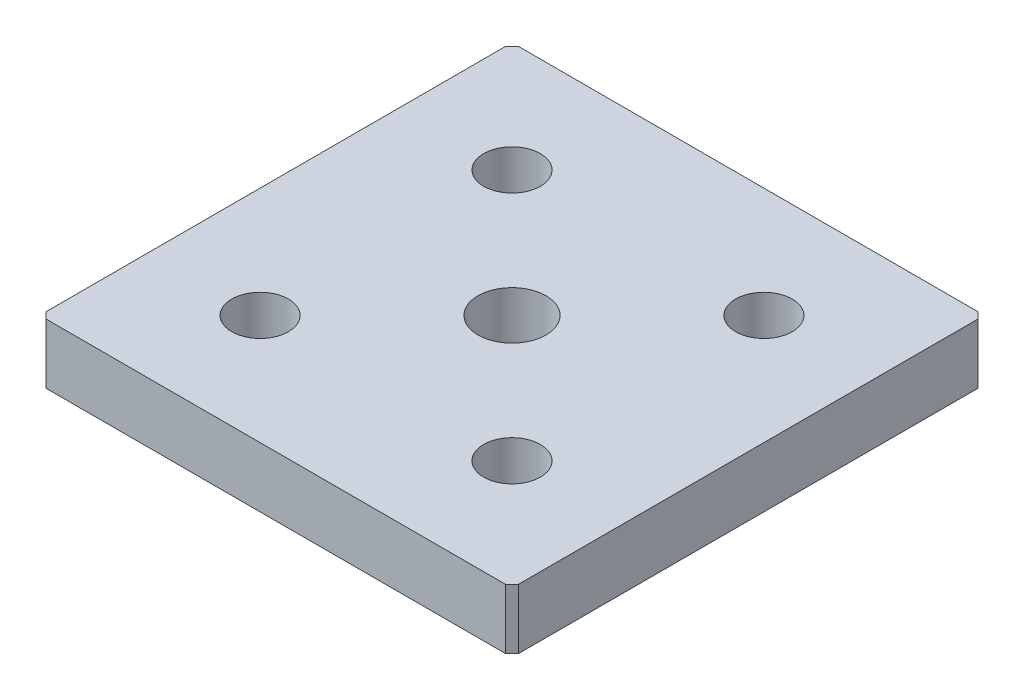
from build123d import *

# Parameters (mm, degrees)
SKETCH1_W               = 75
SKETCH1_H               = 75
BOSS_EXTRUDE1_DEPTH     = 4.7625
M8_CLEARANCE_HOLE1_D    = 9
M12X1_25_TAPPED_HOLE1_D = 10.8
CHAMFER1_SIZE           = 1


with BuildPart() as part:
    # Sketch1 → Boss-Extrude1 (new, symmetric)
    with BuildSketch(Plane(origin=(0, 0, 0), x_dir=(1, 0, 0), z_dir=(0, 1, 0))):
        Rectangle(SKETCH1_W, SKETCH1_H)
    extrude(amount=BOSS_EXTRUDE1_DEPTH, both=True)

    # M8 Clearance Hole1 (through all)
    with Locations(Plane(origin=(0, 4.7625, 0), x_dir=(1, 0, 0), z_dir=(0, 1, 0))):
        with Locations((-20, 20), (20, 20), (-20, -20), (20, -20)):
            Hole(M8_CLEARANCE_HOLE1_D / 2)

    # M12x1.25 Tapped Hole1 (through all)
    with Locations(Plane(origin=(0, 4.7625, 0), x_dir=(1, 0, 0), z_dir=(0, 1, 0))):
        with Locations((0, 0)):
            Hole(M12X1_25_TAPPED_HOLE1_D / 2)

    # Chamfer1
    chamfer1_edges = [part.edges().sort_by_distance(p)[0] for p in [
        (37.5, 0, -37.5),
        (37.5, 0, 37.5),
        (-37.5, 0, 37.5),
        (-37.5, 0, -37.5),
    ]]
    chamfer(chamfer1_edges, length=CHAMFER1_SIZE)


solid = part.part
